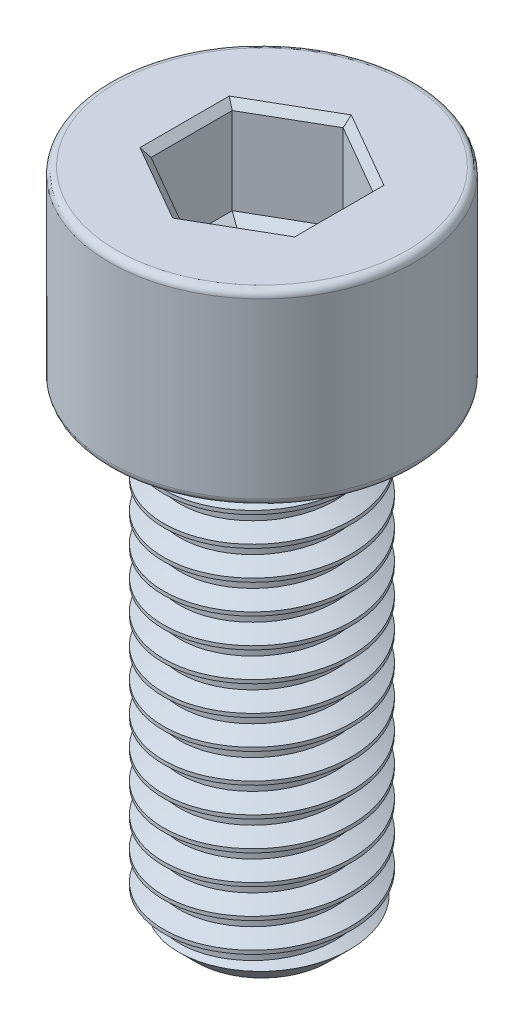
from build123d import *

# Parameters (mm, degrees)
SKETCH1_R           = 4
BOSS_EXTRUDE1_DEPTH = 20
THREAD1_PITCH       = 1.25
SKETCH2_R           = 6.5
BOSS_EXTRUDE2_DEPTH = 8
FILLET1_R           = 0.3
CUT_EXTRUDE1_DEPTH  = 4
CHAMFER1_SIZE       = 0.3
CUT_EXTRUDE2_DEPTH  = 0.4
CUT_EXTRUDE2_DRAFT  = -60


with BuildPart() as part:
    # Sketch1 → Boss-Extrude1 (new body)
    with BuildSketch(Plane(origin=(0, 0, 0), x_dir=(1, 0, 0), z_dir=(0, 1, 0))):
        with Locations(Location((0, 0, 0), (0, 0, 270))):
            Circle(SKETCH1_R)
    extrude(amount=BOSS_EXTRUDE1_DEPTH)

    # Thread1: the profile of Thread Profile1 profile screwed along a right-hand helix of 17 turns, 8 arcs to a turn; built about Z, then put on its axis
    thread1_z = Axis((0, 0, 0), (0, 0, 1))
    thread1_corners = [(4.0003, 0, -0.000173205), (4.0003, 0, 1.093923202), (3.323417656, 0, 0.703124998), (3.323417656, 0, 0.390624998)]
    with BuildLine(mode=Mode.PRIVATE) as thread1_profile:
        Line(thread1_corners[0], thread1_corners[1])
        Line(thread1_corners[1], thread1_corners[2])
        Line(thread1_corners[2], thread1_corners[3])
        Line(thread1_corners[3], thread1_corners[0])
    thread1_cap = Face(thread1_profile.wire())
    thread1_turn_angles = [0, 22.5, 45, 67.5, 90, 112.5, 135, 157.5, 180, 202.5, 225, 247.5, 270, 292.5, 315, 337.5, 360]
    thread1_turn_weights = [1, 0.9238795325112867, 1, 0.9238795325112867, 1, 0.9238795325112867, 1, 0.9238795325112867, 1, 0.9238795325112867, 1, 0.9238795325112867, 1, 0.9238795325112867, 1, 0.9238795325112867, 1]
    thread1_turn_rails = [Edge.make_bspline([Vector(p[0], p[1], 0).rotate(thread1_z, thread1_turn_angles[k]) / thread1_turn_weights[k] + Vector(0, 0, p[2] + THREAD1_PITCH * thread1_turn_angles[k] / 360) for k in range(17)], [0, 0, 0, 1, 1, 2, 2, 3, 3, 4, 4, 5, 5, 6, 6, 7, 7, 8, 8, 8], 2, thread1_turn_weights) for p in thread1_corners]
    thread1_turn_sides = [Face.make_surface_from_curves(thread1_turn_rails[p[0]], thread1_turn_rails[p[1]]) for p in [(0, 1), (1, 2), (2, 3), (3, 0)]]
    thread1 = Plane(origin=(0, 21.25, 0), x_dir=(-1, 0, 0), z_dir=(0, -1, 0)) * Solid(Shell([*[p.moved(Location((0, 0, THREAD1_PITCH * i))) for i in range(17) for p in thread1_turn_sides], thread1_cap, thread1_cap.rotate(thread1_z, 6120).moved(Location((0, 0, THREAD1_PITCH * 6120 / 360)))]))
    add(thread1, mode=Mode.SUBTRACT)

    # Sketch2 → Boss-Extrude2 (add)
    with BuildSketch(Plane(origin=(0, 20, 0), x_dir=(1, 0, 0), z_dir=(0, 1, 0))):
        with Locations(Location((0, 0, 0), (0, 0, 270))):
            Circle(SKETCH2_R)
    extrude(amount=BOSS_EXTRUDE2_DEPTH)

    # Sketch5 → Cut-Revolve1 (revolve, cut)
    with BuildSketch(Plane.XY, mode=Mode.PRIVATE) as cut_revolve1_sk:
        Polygon((4.01, 0), (4.01, 1.2), (2.81, 0), align=None)
    revolve(cut_revolve1_sk.sketch.rotate(Axis((0, 0, 0), (0, 1, 0)), 170.138426735), axis=Axis((0, 0, 0), (0, 1, 0)), mode=Mode.SUBTRACT)

    # Fillet1
    fillet1_edges = [part.edges().sort_by_distance(p)[0] for p in [
        (0, 20, -6.5),
        (0, 28, -6.5),
    ]]
    fillet(fillet1_edges, radius=FILLET1_R)

    # Sketch6 → Cut-Extrude1 (cut)
    with BuildSketch(Plane(origin=(0, 28, 0), x_dir=(1, 0, 0), z_dir=(0, 1, 0))):
        Polygon((0, 3.464101615), (-3, 1.732050808), (-3, -1.732050808), (0, -3.464101615), (3, -1.732050808), (3, 1.732050808), align=None)
    extrude(amount=-CUT_EXTRUDE1_DEPTH, mode=Mode.SUBTRACT)

    # Chamfer1
    chamfer1_edges = [part.edges().sort_by_distance(p)[0] for p in [
        (1.5, 28, -2.598076211),
        (-1.5, 28, -2.598076211),
        (-3, 28, 0),
        (-1.5, 28, 2.598076211),
        (1.5, 28, 2.598076211),
        (3, 28, 0),
    ]]
    chamfer(chamfer1_edges, length=CHAMFER1_SIZE)


with BuildPart() as cut_extrude2_tool:
    # Sketch7 → Cut-Extrude2 (with draft: the straight prism first)
    with BuildSketch(Plane(origin=(0, 24, 0), x_dir=(1, 0, 0), z_dir=(0, 1, 0))):
        Polygon((0, 3.464101615), (-3, 1.732050808), (-3, -1.732050808), (0, -3.464101615), (3, -1.732050808), (3, 1.732050808), align=None)
    extrude(amount=-CUT_EXTRUDE2_DEPTH)
    # Cut-Extrude2: the draft: its side faces are tilted about the plane it starts from
    cut_extrude2_sides = [cut_extrude2_tool.faces().sort_by_distance(p)[0] for p in [
        (-1.5, 23.8, -2.598076211),
        (-3, 23.8, 0),
        (-1.5, 23.8, 2.598076211),
        (1.5, 23.8, 2.598076211),
        (3, 23.8, 0),
        (1.5, 23.8, -2.598076211),
    ]]
    draft(cut_extrude2_sides, Plane(origin=(0, 24, 0), x_dir=(1, 0, 0), z_dir=(0, 1, 0)), CUT_EXTRUDE2_DRAFT)


with BuildPart() as part_1:
    add(part.part)

    # Cut-Extrude2: cut by cut_extrude2_tool
    add(cut_extrude2_tool.part, mode=Mode.SUBTRACT)


solid = part_1.part
